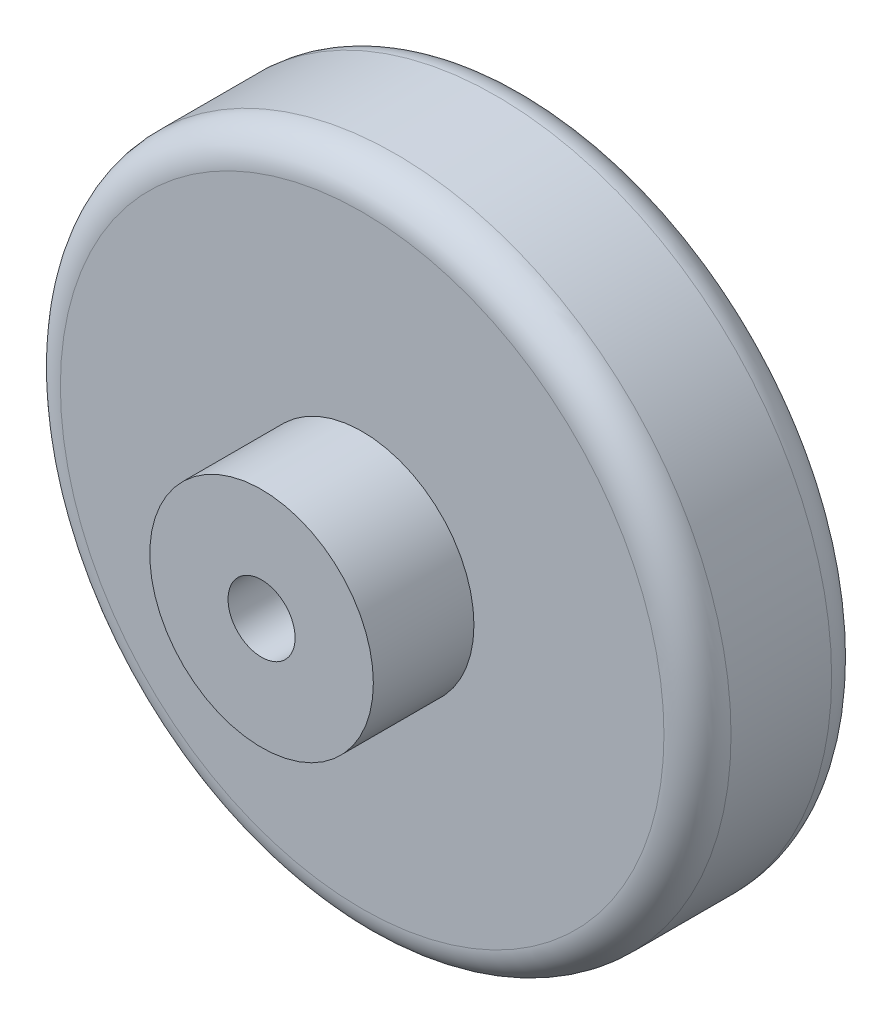
from build123d import *

# Parameters (mm, degrees)
SKETCH1_R           = 30
BOSS_EXTRUDE1_DEPTH = 15
SKETCH2_R           = 10
BOSS_EXTRUDE2_DEPTH = 9
SKETCH3_R           = 3
CUT_EXTRUDE1_DEPTH  = 49.744230428
FILLET1_R           = 3
SKETCH4_R           = 6
CUT_EXTRUDE2_DEPTH  = 4
FILLET2_R           = 1


with BuildPart() as part:
    # Sketch1 → Boss-Extrude1 (new body)
    with BuildSketch(Plane.XY):
        Circle(SKETCH1_R)
    extrude(amount=BOSS_EXTRUDE1_DEPTH)

    # Sketch2 → Boss-Extrude2 (add)
    with BuildSketch(Plane.XY.offset(15)):
        Circle(SKETCH2_R)
    extrude(amount=BOSS_EXTRUDE2_DEPTH)

    # Sketch3 → Cut-Extrude1 (cut, through all)
    with BuildSketch(Plane.XY.offset(24)):
        Circle(SKETCH3_R)
    extrude(amount=-CUT_EXTRUDE1_DEPTH, mode=Mode.SUBTRACT)

    # Fillet1
    fillet1_edges = [part.edges().sort_by_distance(p)[0] for p in [
        (-30, 0, 0),
        (-30, 0, 15),
    ]]
    fillet(fillet1_edges, radius=FILLET1_R)

    # Sketch4 → Cut-Extrude2 (cut)
    with BuildSketch(Plane(origin=(0, 0, 0), x_dir=(-1, 0, 0), z_dir=(0, 0, -1))):
        Circle(SKETCH4_R)
    extrude(amount=-CUT_EXTRUDE2_DEPTH, mode=Mode.SUBTRACT)

    # Fillet2
    fillet2_edges = [part.edges().sort_by_distance(p)[0] for p in [
        (6, 0, 0),
    ]]
    fillet(fillet2_edges, radius=FILLET2_R)


solid = part.part
